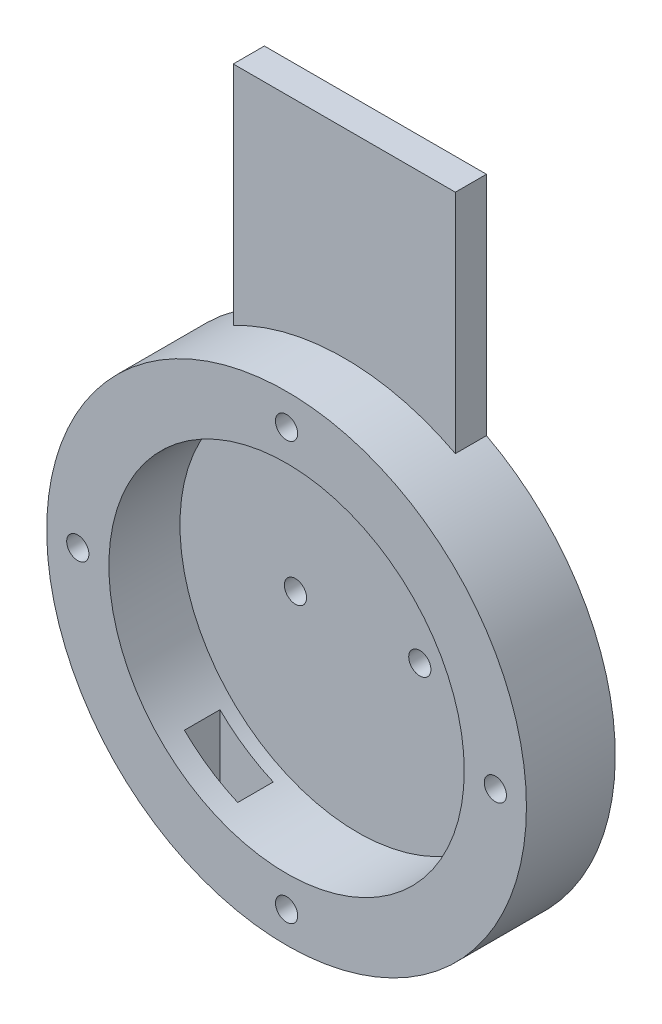
from build123d import *

# Parameters (mm, degrees)
SKETCH1_R               = 27
SKETCH1_R_2             = 1.25
SKETCH1_R_3             = 20
BOSS_EXTRUDE1_DEPTH     = 10
SKETCH3_R               = 20
SKETCH3_R_2             = 1.25
BOSS_EXTRUDE2_DEPTH     = 2
BOSS_EXTRUDE3_DEPTH     = 3.5
CUT_EXTRUDE1_REACH      = 59.191
CUT_EXTRUDE1_END_RADIUS = 27
SKETCH4_W               = 6
SKETCH4_H               = 4


with BuildPart() as part:
    # Sketch1 → Boss-Extrude1 (new body)
    with BuildSketch(Plane.XY):
        Circle(SKETCH1_R)
        with Locations((0, 23.5)):
            Circle(SKETCH1_R_2, mode=Mode.SUBTRACT)
        with Locations((23.5, 0)):
            Circle(SKETCH1_R_2, mode=Mode.SUBTRACT)
        with Locations((0, -23.5)):
            Circle(SKETCH1_R_2, mode=Mode.SUBTRACT)
        with Locations((-23.5, 0)):
            Circle(SKETCH1_R_2, mode=Mode.SUBTRACT)
        Circle(SKETCH1_R_3, mode=Mode.SUBTRACT)
    extrude(amount=BOSS_EXTRUDE1_DEPTH)

    # Sketch3 → Boss-Extrude2 (add)
    with BuildSketch(Plane.XY):
        Circle(SKETCH3_R)
        with Locations((-7, 0)):
            Circle(SKETCH3_R_2, mode=Mode.SUBTRACT)
        with Locations((7, 0)):
            Circle(SKETCH3_R_2, mode=Mode.SUBTRACT)
    extrude(amount=BOSS_EXTRUDE2_DEPTH)

    # Sketch5 → Boss-Extrude3 (add)
    with BuildSketch(Plane.XY):
        Polygon((-12.5, 23.932195888), (-4.251935746, 23.932195888), (0, 26.25446737), (4.267780323, 23.932195888), (12.5, 23.932195888), (12.5, 49.414469913), (-12.5, 49.414469913), align=None)
    extrude(amount=BOSS_EXTRUDE3_DEPTH)

    # Cut-Extrude1: up to this cylinder (the profile starts inside it)
    cut_extrude1_end = Plane(origin=(0, 0, 5.5), z_dir=(0, 0, -1)) * Cylinder(CUT_EXTRUDE1_END_RADIUS, 173.382, mode=Mode.PRIVATE)
    # Sketch4 → Cut-Extrude1 (cut, up to the surface)
    with BuildSketch(Plane(origin=(0, 0, 0), x_dir=(1, 0, 0), z_dir=(0, 1, 0)), mode=Mode.PRIVATE) as cut_extrude1_sk1:
        with Locations((-11, -5.5)):
            Rectangle(SKETCH4_W, SKETCH4_H)
    cut_extrude1_tool1 = extrude(cut_extrude1_sk1.sketch, amount=-CUT_EXTRUDE1_REACH, mode=Mode.PRIVATE) & cut_extrude1_end
    add(cut_extrude1_tool1.solids().sort_by_distance((-11, 0, 5.5))[0], mode=Mode.SUBTRACT)


solid = part.part
